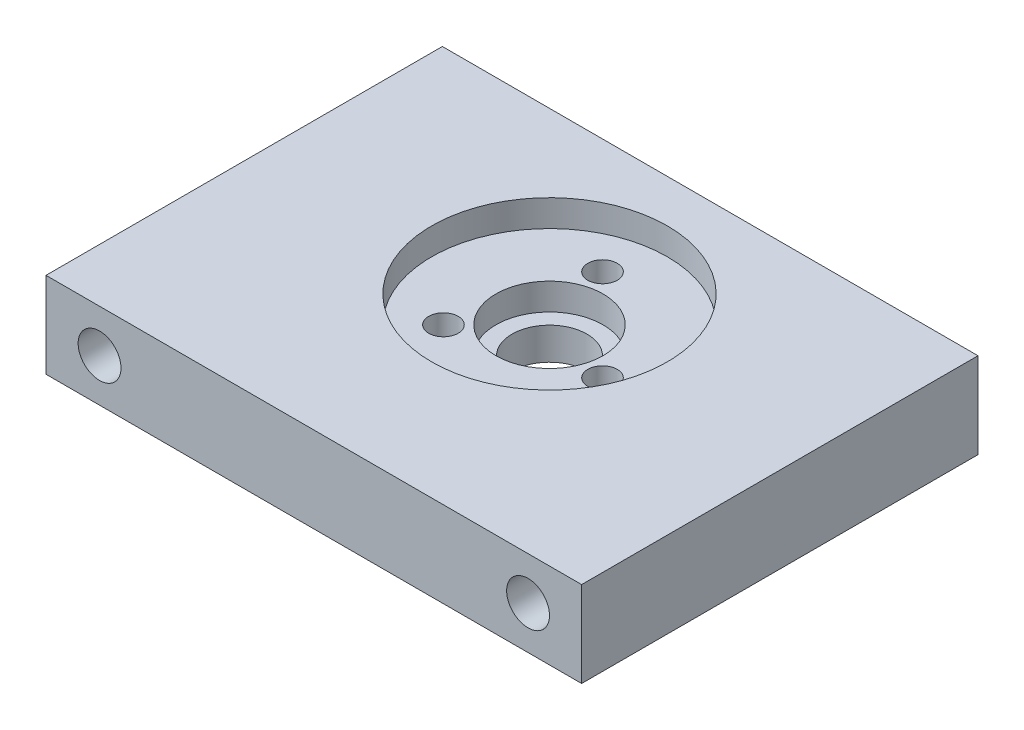
from build123d import *

# Parameters (mm, degrees)
ESQUISSE1_W             = 50
ESQUISSE1_H             = 37
BOSS_EXTRU_1_DEPTH      = 8
ESQUISSE2_R             = 5
ENL_V_MAT_EXTRU_1_DEPTH = 5
ESQUISSE3_R             = 1.375
ESQUISSE3_R_2           = 3.5
ENL_V_MAT_EXTRU_2_DEPTH = 15
ESQUISSE4_R             = 11
ENL_V_MAT_EXTRU_3_DEPTH = 2.5
ESQUISSE5_R             = 2.25
ENL_V_MAT_EXTRU_4_DEPTH = 2.5
ESQUISSE6_R             = 2
ENL_V_MAT_EXTRU_5_DEPTH = 10


with BuildPart() as part:
    # Esquisse1 → Boss.-Extru.1 (new body)
    with BuildSketch(Plane(origin=(0, 0, 0), x_dir=(1, 0, 0), z_dir=(0, 1, 0))):
        Rectangle(ESQUISSE1_W, ESQUISSE1_H)
    extrude(amount=BOSS_EXTRU_1_DEPTH)

    # Esquisse2 → Enlèv. mat.-Extru.1 (cut)
    with BuildSketch(Plane(origin=(0, 8, 0), x_dir=(1, 0, 0), z_dir=(0, 1, 0))):
        with Locations((0, 3.5)):
            Circle(ESQUISSE2_R)
    extrude(amount=-ENL_V_MAT_EXTRU_1_DEPTH, mode=Mode.SUBTRACT)

    # Esquisse3 → Enlèv. mat.-Extru.2 (cut)
    with BuildSketch(Plane(origin=(0, 8, 0), x_dir=(1, 0, 0), z_dir=(0, 1, 0))):
        with Locations((-1.811733316, 10.261480784)):
            Circle(ESQUISSE3_R)
        with Locations((6.761480784, 1.688266684)):
            Circle(ESQUISSE3_R)
        with Locations((-4.949747468, -1.449747468)):
            Circle(ESQUISSE3_R)
        with Locations((0, 3.5)):
            Circle(ESQUISSE3_R_2)
    extrude(amount=-ENL_V_MAT_EXTRU_2_DEPTH, mode=Mode.SUBTRACT)

    # Esquisse4 → Enlèv. mat.-Extru.3 (cut)
    with BuildSketch(Plane(origin=(0, 8, 0), x_dir=(1, 0, 0), z_dir=(0, 1, 0))):
        with Locations((0, 3.5)):
            Circle(ESQUISSE4_R)
    extrude(amount=-ENL_V_MAT_EXTRU_3_DEPTH, mode=Mode.SUBTRACT)

    # Esquisse5 → Enlèv. mat.-Extru.4 (cut)
    with BuildSketch(Plane.XZ):
        with Locations((-4.949747468, 1.449747468)):
            Circle(ESQUISSE5_R)
        with Locations((6.761480784, -1.688266684)):
            Circle(ESQUISSE5_R)
        with Locations((-1.811733316, -10.261480784)):
            Circle(ESQUISSE5_R)
    extrude(amount=-ENL_V_MAT_EXTRU_4_DEPTH, mode=Mode.SUBTRACT)

    # Esquisse6 → Enlèv. mat.-Extru.5 (cut)
    with BuildSketch(Plane.XY.offset(18.5)):
        with Locations((-20, 4)):
            Circle(ESQUISSE6_R)
        with Locations((20, 4)):
            Circle(ESQUISSE6_R)
    extrude(amount=-ENL_V_MAT_EXTRU_5_DEPTH, mode=Mode.SUBTRACT)


solid = part.part
